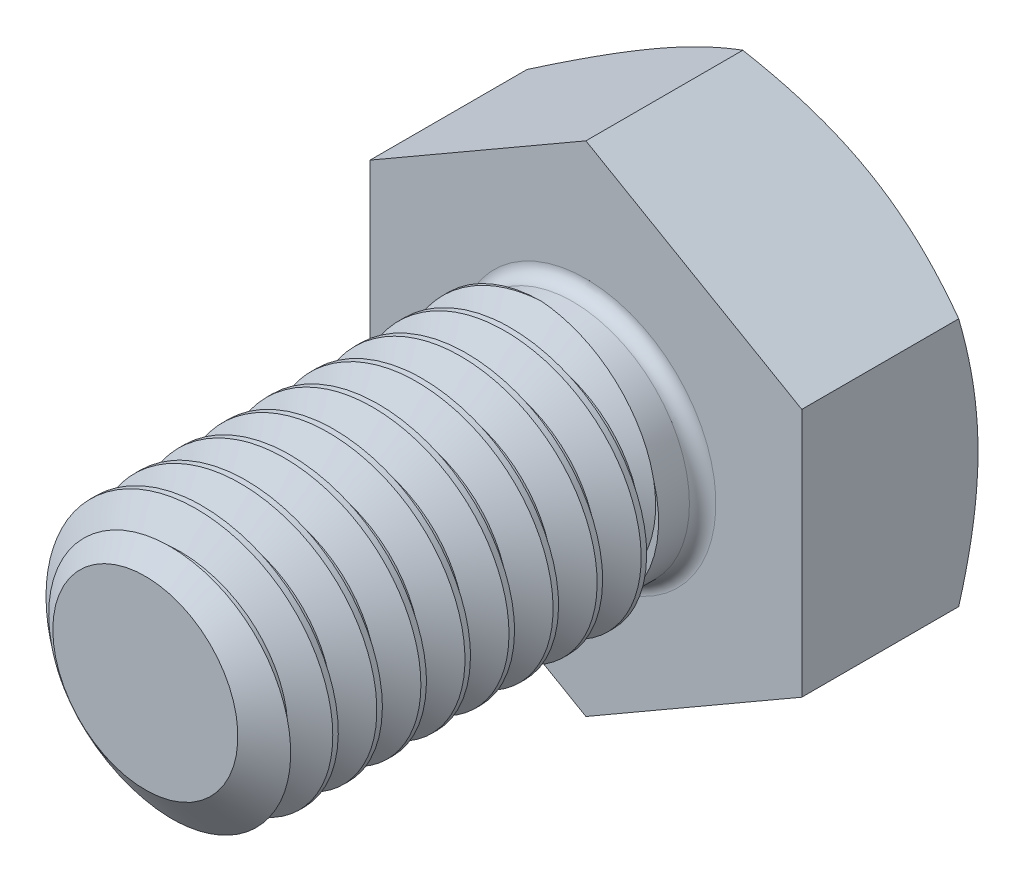
from build123d import *
from build123d.topology import SkipClean

# Parameters (mm, degrees)
SKETCH1_R           = 3
BOSS_EXTRUDE1_DEPTH = 10
CUT_SWEEP1_PITCH    = 1
BOSS_EXTRUDE2_DEPTH = 4
SKETCH6_OUTSIDE_W   = 19.364
SKETCH6_OUTSIDE_H   = 20.88
SKETCH6_OUTSIDE_R   = 4.9
CUT_EXTRUDE1_DEPTH  = 1
CUT_EXTRUDE1_DRAFT  = -60
SKETCH7_W           = 1
SKETCH7_H           = 3
SKETCH8_W           = 1
SKETCH8_H           = 0.35
FILLET1_R           = 0.3


with BuildPart() as part:
    # Sketch1 → Boss-Extrude1 (new body)
    with BuildSketch(Plane.XY):
        Circle(SKETCH1_R)
    extrude(amount=-BOSS_EXTRUDE1_DEPTH)

    # Cut-Sweep1: the profile of Sketch3 profile screwed along a right-hand helix of 52 turns, 6 arcs to a turn; built about Z, then put on its axis
    cut_sweep1_z = Axis((0, 0, 0), (0, 0, 1))
    cut_sweep1_corners = [(3.0003, 0, -0.875173205), (3.0003, 0, 0.000173205), (2.350480947, 0, -0.375), (2.350480947, 0, -0.5)]
    with BuildLine(mode=Mode.PRIVATE) as cut_sweep1_profile:
        Line(cut_sweep1_corners[0], cut_sweep1_corners[1])
        Line(cut_sweep1_corners[1], cut_sweep1_corners[2])
        Line(cut_sweep1_corners[2], cut_sweep1_corners[3])
        Line(cut_sweep1_corners[3], cut_sweep1_corners[0])
    cut_sweep1_cap = Face(cut_sweep1_profile.wire())
    cut_sweep1_turn_angles = [0, 30, 60, 90, 120, 150, 180, 210, 240, 270, 300, 330, 360, 390, 420, 450, 480, 510, 540, 570, 600, 630, 660, 690, 720]
    cut_sweep1_turn_weights = [1, 0.8660254037844387, 1, 0.8660254037844387, 1, 0.8660254037844387, 1, 0.8660254037844387, 1, 0.8660254037844387, 1, 0.8660254037844387, 1, 0.8660254037844387, 1, 0.8660254037844387, 1, 0.8660254037844387, 1, 0.8660254037844387, 1, 0.8660254037844387, 1, 0.8660254037844387, 1]
    cut_sweep1_turn_rails = [Edge.make_bspline([Vector(p[0], p[1], 0).rotate(cut_sweep1_z, cut_sweep1_turn_angles[k]) / cut_sweep1_turn_weights[k] + Vector(0, 0, p[2] + CUT_SWEEP1_PITCH * cut_sweep1_turn_angles[k] / 360) for k in range(25)], [0, 0, 0, 1, 1, 2, 2, 3, 3, 4, 4, 5, 5, 6, 6, 7, 7, 8, 8, 9, 9, 10, 10, 11, 11, 12, 12, 12], 2, cut_sweep1_turn_weights) for p in cut_sweep1_corners]
    cut_sweep1_turn_sides = [Face.make_surface_from_curves(cut_sweep1_turn_rails[p[0]], cut_sweep1_turn_rails[p[1]]) for p in [(0, 1), (1, 2), (2, 3), (3, 0)]]
    cut_sweep1 = Plane(origin=(0, 0, 0), x_dir=(0, 1, 0), z_dir=(0, 0, -1)) * Solid(Shell([*[p.moved(Location((0, 0, 2 * CUT_SWEEP1_PITCH * i))) for i in range(26) for p in cut_sweep1_turn_sides], cut_sweep1_cap, cut_sweep1_cap.rotate(cut_sweep1_z, 18720).moved(Location((0, 0, CUT_SWEEP1_PITCH * 18720 / 360)))]))
    add(cut_sweep1, mode=Mode.SUBTRACT)

    # Sketch4 → Cut-Revolve1 (revolve, cut)
    with BuildSketch(Plane(origin=(0, 0, 0), x_dir=(0, 0, -1), z_dir=(1, 0, 0)), mode=Mode.PRIVATE) as cut_revolve1_sk:
        Polygon((0, 3), (0.630186784, 3), (0, 2.1), align=None)
    revolve(cut_revolve1_sk.sketch.rotate(Axis((0, 0, -10), (0, 0, 1)), 90), axis=Axis((0, 0, -10), (0, 0, 1)), mode=Mode.SUBTRACT)

    # Sketch5 → Boss-Extrude2 (add)
    with BuildSketch(Plane(origin=(0, 0, -10), x_dir=(-1, 0, 0), z_dir=(0, 0, -1))):
        Polygon((4.9, -2.829016319), (4.9, 2.829016319), (0, 5.658032638), (-4.9, 2.829016319), (-4.9, -2.829016319), (0, -5.658032638), align=None)
    extrude(amount=BOSS_EXTRUDE2_DEPTH)


with BuildPart() as cut_extrude1_tool:
    # Sketch6 outside → Cut-Extrude1 (with draft: the straight prism first)
    with BuildSketch(Plane(origin=(0, 0, -14), x_dir=(-1, 0, 0), z_dir=(0, 0, -1))):
        Rectangle(SKETCH6_OUTSIDE_W, SKETCH6_OUTSIDE_H)
        Circle(SKETCH6_OUTSIDE_R, mode=Mode.SUBTRACT)
    extrude(amount=-CUT_EXTRUDE1_DEPTH)
    # Cut-Extrude1: the draft: its side faces are tilted about the plane it starts from
    cut_extrude1_sides = [cut_extrude1_tool.faces().sort_by_distance(p)[0] for p in [
        (0, -10.44, -13.5),
        (-9.682, 0, -13.5),
        (0, 10.44, -13.5),
        (9.682, 0, -13.5),
        (4.9, 0, -13.5),
    ]]
    draft(cut_extrude1_sides, Plane(origin=(0, 0, -14), x_dir=(-1, 0, 0), z_dir=(0, 0, -1)), CUT_EXTRUDE1_DRAFT)


with BuildPart() as part_1:
    add(part.part)

    # Cut-Extrude1: cut by cut_extrude1_tool
    add(cut_extrude1_tool.part, mode=Mode.SUBTRACT)

    # Sketch7 → Revolve1 (revolve)
    with SkipClean():  # the faces are left unmerged after this step: merging them gives an invalid solid
        with BuildSketch(Plane(origin=(0, 0, 0), x_dir=(0, 0, -1), z_dir=(1, 0, 0)), mode=Mode.PRIVATE) as revolve1_sk:
            with Locations((9.5, 1.5)):
                Rectangle(SKETCH7_W, SKETCH7_H)
        revolve(revolve1_sk.sketch.rotate(Axis((0, 0, -10), (0, 0, 1)), 270), axis=Axis((0, 0, -10), (0, 0, 1)))

    # Sketch8 → Cut-Revolve2 (revolve, cut)
    with BuildSketch(Plane(origin=(0, 0, 0), x_dir=(0, 0, -1), z_dir=(1, 0, 0)), mode=Mode.PRIVATE) as cut_revolve2_sk:
        with Locations((9.5, 2.825)):
            Rectangle(SKETCH8_W, SKETCH8_H)
    revolve(cut_revolve2_sk.sketch.rotate(Axis((0, 0, -10), (0, 0, 1)), 90), axis=Axis((0, 0, -10), (0, 0, 1)), mode=Mode.SUBTRACT)

    # Fillet1
    fillet1_edges = [part_1.edges().sort_by_distance(p)[0] for p in [
        (2.65, 0, -10),
    ]]
    fillet(fillet1_edges, radius=FILLET1_R)


solid = part_1.part
